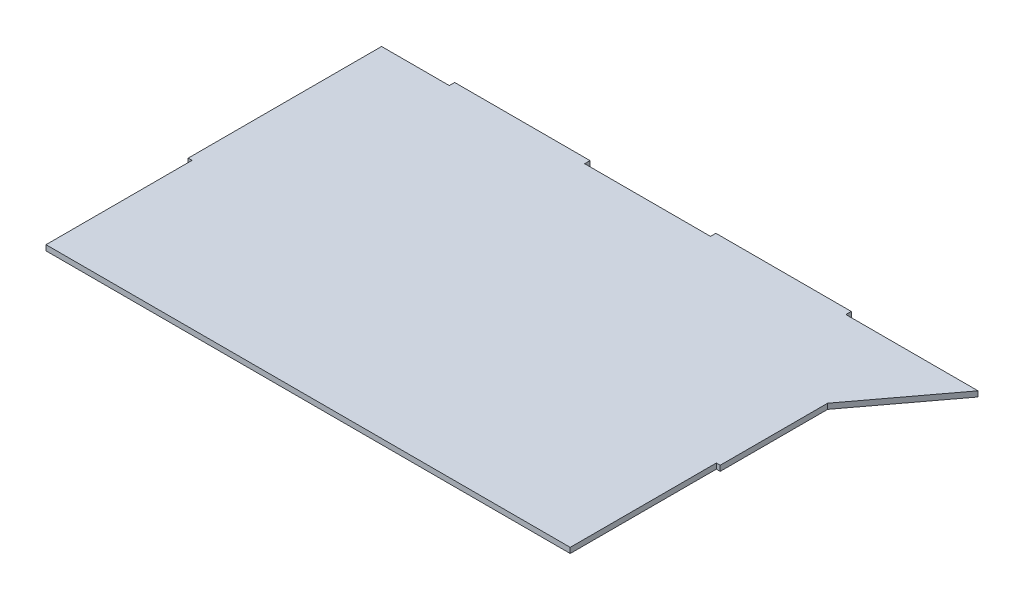
from build123d import *

# Parameters (mm, degrees)
SKETCH1_W           = 314.4612
SKETCH1_H           = 3.175
BOSS_EXTRUDE1_DEPTH = 200.66180012
CUT_EXTRUDE2_START  = -3.175
SKETCH5_W           = 2.286
SKETCH5_H           = 86.36
CUT_EXTRUDE2_DEPTH  = 259.119504214
SKETCH3_W           = 80
SKETCH3_H           = 3.175
BOSS_EXTRUDE2_DEPTH = 3.175
LPATTERN2_COUNT     = 2
LPATTERN2_PITCH     = 154.43
BOSS_EXTRUDE3_DEPTH = 3.175


with BuildPart() as part:
    # Sketch1 → Boss-Extrude1 (new body)
    with BuildSketch(Plane.XY):
        Rectangle(SKETCH1_W, SKETCH1_H)
    extrude(amount=BOSS_EXTRUDE1_DEPTH)

    # Sketch5 → Cut-Extrude2 (cut)
    with BuildSketch(Plane(origin=(0, 1.5875, 0), x_dir=(1, 0, 0), z_dir=(0, 1, 0)).offset(CUT_EXTRUDE2_START)):
        with Locations((-156.0876, -157.48180012)):
            Rectangle(SKETCH5_W, SKETCH5_H)
    cut_extrude2 = extrude(amount=CUT_EXTRUDE2_DEPTH, mode=Mode.SUBTRACT)

    # Mirror1: Cut-Extrude2 across plane
    add(cut_extrude2.mirror(Plane(origin=(0, 0, 0), x_dir=(0, 0, 1), z_dir=(1, 0, 0))), mode=Mode.SUBTRACT)

    # Sketch3 → Boss-Extrude2 (add)
    with BuildSketch(Plane(origin=(0, 0, 0), x_dir=(-1, 0, 0), z_dir=(0, 0, -1))):
        with Locations((-77.2306, 0)):
            Rectangle(SKETCH3_W, SKETCH3_H)
    boss_extrude2 = extrude(amount=BOSS_EXTRUDE2_DEPTH)

    # LPattern2: Boss-Extrude2 ×2
    with Locations(*[(-i * LPATTERN2_PITCH, 0, 0) for i in range(1, LPATTERN2_COUNT)]):
        add(boss_extrude2)

    # Sketch10 → Boss-Extrude3 (add)
    with BuildSketch(Plane.XZ.offset(1.5875)):
        Polygon((157.2306, 0), (195.3306, 0), (157.2306, 50.8), align=None)
    extrude(amount=-BOSS_EXTRUDE3_DEPTH)


solid = part.part
